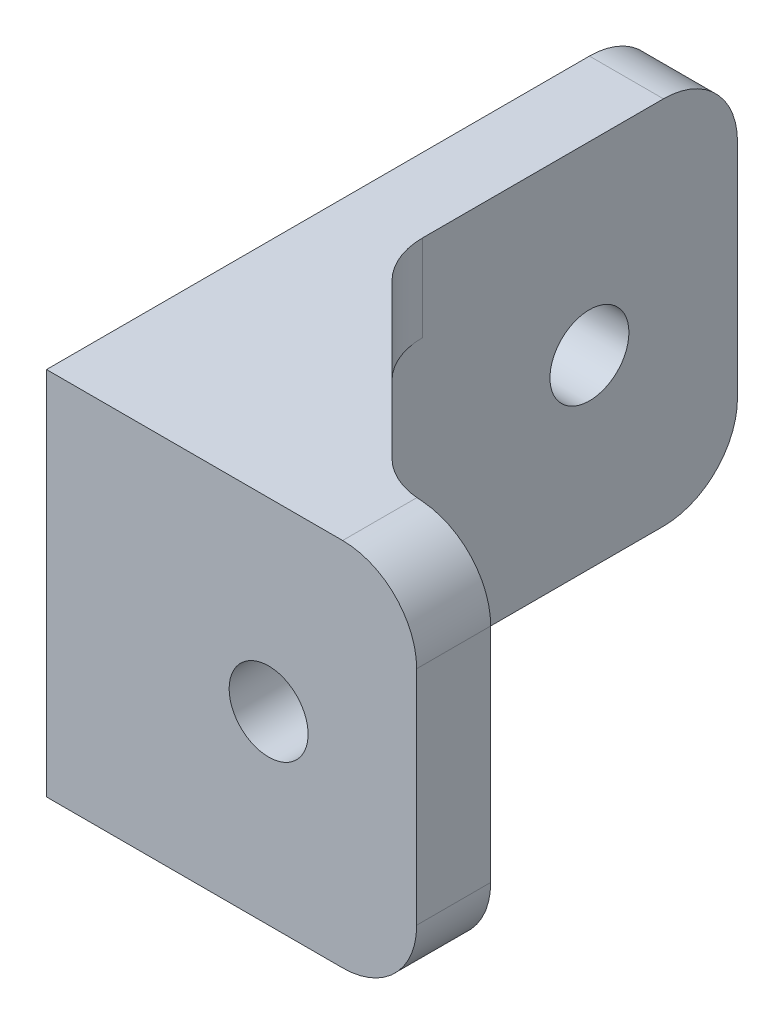
from build123d import *

# Parameters (mm, degrees)
SKETCH1_W           = 3
SKETCH1_H           = 22
SKETCH1_H_2         = 3
SKETCH1_W_2         = 12
BOSS_EXTRUDE1_DEPTH = 15
SKETCH2_R           = 1.6
CUT_EXTRUDE1_DEPTH  = 31.56141358
SKETCH3_R           = 1.6
CUT_EXTRUDE2_DEPTH  = 32.527765541
FILLET1_R           = 3
CHAMFER1_SIZE       = 8
SKETCH6_W           = 8
SKETCH6_H           = 8
CUT_EXTRUDE5_DEPTH  = 12
FILLET2_R           = 3
SKETCH7_W           = 15
SKETCH7_H           = 25
CUT_EXTRUDE6_DEPTH  = 33.787192713


with BuildPart() as part:
    # Sketch1 → Boss-Extrude1 (new body)
    with BuildSketch(Plane(origin=(0, 0, 0), x_dir=(1, 0, 0), z_dir=(0, 1, 0))):
        with Locations((1.5, 14)):
            Rectangle(SKETCH1_W, SKETCH1_H)
        with Locations((1.5, 1.5)):
            Rectangle(SKETCH1_W, SKETCH1_H_2)
        with Locations((9, 1.5)):
            Rectangle(SKETCH1_W_2, SKETCH1_H_2)
    extrude(amount=BOSS_EXTRUDE1_DEPTH)

    # Sketch2 → Cut-Extrude1 (cut, through all)
    with BuildSketch(Plane(origin=(0, 0, -3), x_dir=(-1, 0, 0), z_dir=(0, 0, -1))):
        with Locations((-9, 7.5)):
            Circle(SKETCH2_R)
    extrude(amount=-CUT_EXTRUDE1_DEPTH, mode=Mode.SUBTRACT)

    # Sketch3 → Cut-Extrude2 (cut, through all)
    with BuildSketch(Plane(origin=(3, 0, 0), x_dir=(0, 0, -1), z_dir=(1, 0, 0))):
        with Locations((9, 7.5)):
            Circle(SKETCH3_R)
        with Locations((19, 7.5)):
            Circle(SKETCH3_R)
    extrude(amount=-CUT_EXTRUDE2_DEPTH, mode=Mode.SUBTRACT)

    # Fillet1
    fillet1_edges = [part.edges().sort_by_distance(p)[0] for p in [
        (15, 15, -1.5),
        (1.5, 15, -25),
        (1.5, 0, -25),
        (15, 0, -1.5),
    ]]
    fillet(fillet1_edges, radius=FILLET1_R)

    # Chamfer1
    # the kernel refuses this chamfer: 8 mm, written as the material it adds along each edge
    with BuildSketch(Plane(origin=(3, 0, -3), x_dir=(-0.027495876610586382, 0, -0.9996219169112968), z_dir=(0, 1, 0))) as chamfer1_piece_1_section:
        Polygon((CHAMFER1_SIZE * 0.999621916911, -CHAMFER1_SIZE * 0.0274958766106), (-CHAMFER1_SIZE * 0.0274958766106, -CHAMFER1_SIZE * 0.999621916911), (0, 0), align=None)
    chamfer1_piece_1 = extrude(amount=15, mode=Mode.PRIVATE)
    chamfer1_piece_1 = chamfer1_piece_1 - Plane(origin=(5.584357769, 7.5, -9), x_dir=(0, 0, -1), z_dir=(1, 0, 0)) * Cylinder(1.6, 62, mode=Mode.PRIVATE)
    chamfer1_piece_1 = chamfer1_piece_1 - Plane(origin=(9, 7.5, -5.584358399), x_dir=(-1, 0, 0), z_dir=(0, 0, -1)) * Cylinder(1.6, 62, mode=Mode.PRIVATE)
    add(chamfer1_piece_1)

    # Sketch6 → Cut-Extrude5 (cut)
    with BuildSketch(Plane(origin=(15, 0, 0), x_dir=(0, 0, -1), z_dir=(1, 0, 0))):
        with Locations((7, 7.5)):
            Rectangle(SKETCH6_W, SKETCH6_H)
    extrude(amount=-CUT_EXTRUDE5_DEPTH, mode=Mode.SUBTRACT)

    # Fillet2
    fillet2_edges = [part.edges().sort_by_distance(p)[0] for p in [
        (3, 7.5, -3),
        (11, 1.75, -3),
        (3, 1.75, -11),
        (3, 13.25, -11),
        (11, 13.25, -3),
    ]]
    fillet(fillet2_edges, radius=FILLET2_R)

    # Mirror3: part across plane


with BuildPart() as part_1:
    add(part.part)
    add(part.part.mirror(Plane(origin=(0, 15, 0), x_dir=(0, 0, 1), z_dir=(-1, 0, 0))))

    # Sketch7 → Cut-Extrude6 (cut, through all)
    with BuildSketch(Plane.XZ):
        with Locations((-7.5, -12.5)):
            Rectangle(SKETCH7_W, SKETCH7_H)
    extrude(amount=-CUT_EXTRUDE6_DEPTH, mode=Mode.SUBTRACT)


solid = part_1.part
